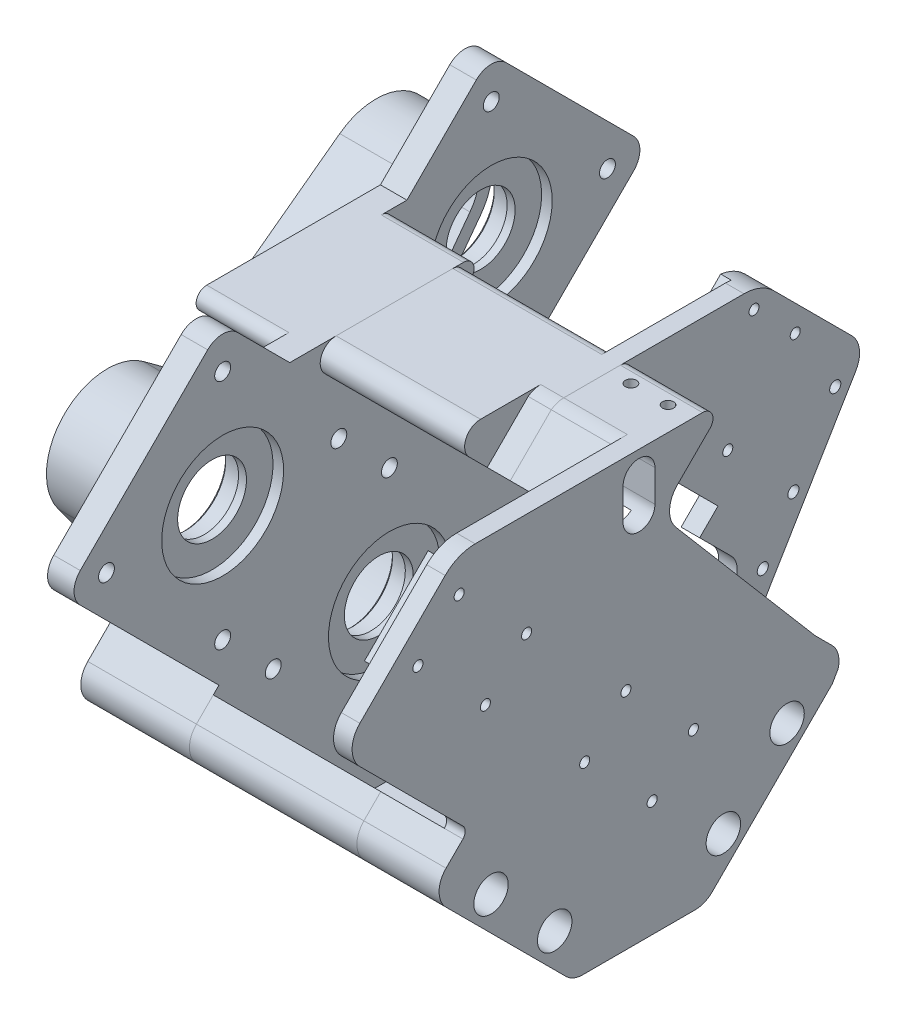
from build123d import *

# Parameters (mm, degrees)
SKETCH1_W                     = 42
SKETCH1_H                     = 42
BOSS_EXTRUDE1_DEPTH           = 5
SKETCH2_R                     = 1.5
CUT_EXTRUDE1_DEPTH            = 31.116440693
SKETCH3_R                     = 11.5
CUT_EXTRUDE2_DEPTH            = 31.116440693
SKETCH4_R                     = 3
CUT_EXTRUDE3_DEPTH            = 2
BOSS_EXTRUDE2_START           = -1.5
SKETCH5_R                     = 11.5
SKETCH5_R_2                   = 6.5
BOSS_EXTRUDE2_DEPTH           = 1.5
BOSS_EXTRUDE3_START           = 4
SKETCH6_R                     = 11.5
SKETCH6_R_2                   = 7.575
BOSS_EXTRUDE3_DEPTH           = 4
BODY_MOVE_COPY1_ANGLE         = 90
BODY_MOVE_COPY2_ANGLE         = 45
BODY_MOVE_COPY3_START         = -5
BODY_MOVE_COPY3_OUTLINE_R     = 3
BODY_MOVE_COPY3_OUTLINE_R_2   = 11.5
BODY_MOVE_COPY3_DEPTH         = 5
BODY_MOVE_COPY3_START_2       = -7.5
BODY_MOVE_COPY3_2_OUTLINE_R   = 11.5
BODY_MOVE_COPY3_2_OUTLINE_R_2 = 7.575
BODY_MOVE_COPY3_2_DEPTH       = 5.5
BODY_MOVE_COPY3_START_3       = -3
BODY_MOVE_COPY3_3_OUTLINE_R   = 3
BODY_MOVE_COPY3_3_OUTLINE_R_2 = 1.5
BODY_MOVE_COPY3_3_DEPTH       = 3
BODY_MOVE_COPY3_START_4       = -3.5
BODY_MOVE_COPY3_4_OUTLINE_R   = 7.575
BODY_MOVE_COPY3_4_OUTLINE_R_2 = 6.5
BODY_MOVE_COPY3_4_DEPTH       = 1.5
BODY_MOVE_COPY5_START         = -5
BODY_MOVE_COPY5_OUTLINE_R     = 3
BODY_MOVE_COPY5_OUTLINE_R_2   = 11.5
BODY_MOVE_COPY5_DEPTH         = 5
BODY_MOVE_COPY5_START_2       = -7.5
BODY_MOVE_COPY5_2_OUTLINE_R   = 11.5
BODY_MOVE_COPY5_2_OUTLINE_R_2 = 7.575
BODY_MOVE_COPY5_2_DEPTH       = 5.5
BODY_MOVE_COPY5_START_3       = -3
BODY_MOVE_COPY5_3_OUTLINE_R   = 3
BODY_MOVE_COPY5_3_OUTLINE_R_2 = 1.5
BODY_MOVE_COPY5_3_DEPTH       = 3
BODY_MOVE_COPY5_START_4       = -3.5
BODY_MOVE_COPY5_4_OUTLINE_R   = 7.575
BODY_MOVE_COPY5_4_OUTLINE_R_2 = 6.5
BODY_MOVE_COPY5_4_DEPTH       = 1.5
BOSS_EXTRUDE4_DEPTH           = 5
BOSS_EXTRUDE5_START           = -5
BOSS_EXTRUDE5_DEPTH           = 20.5
SKETCH12_R                    = 4.5
BOSS_EXTRUDE6_DEPTH           = 20.5
BOSS_EXTRUDE6_2_DEPTH         = 20.5
BOSS_EXTRUDE6_3_DEPTH         = 20.5
BOSS_EXTRUDE6_4_DEPTH         = 20.5
BOSS_EXTRUDE6_5_DEPTH         = 20.5
BOSS_EXTRUDE6_6_DEPTH         = 20.5
BOSS_EXTRUDE7_DEPTH           = 20.5
FILLET1_R                     = 2
FILLET3_R                     = 2
BOSS_EXTRUDE8_START           = -20.5
BOSS_EXTRUDE8_DEPTH           = 20.5
FILLET4_R                     = 4
CUT_EXTRUDE4_REACH            = 93.688
SKETCH15_R                    = 1.4
CUT_EXTRUDE5_REACH            = 93.688
SKETCH17_R                    = 1.4
CHAMFER1_SIZE                 = 0.5
BOSS_EXTRUDE9_DEPTH           = 2
SKETCH19_R                    = 0.95
CUT_EXTRUDE6_DEPTH            = 2
BOSS_EXTRUDE10_DEPTH          = 2
BOSS_EXTRUDE10_2_DEPTH        = 2
SKETCH22_R                    = 0.95
CUT_EXTRUDE7_DEPTH            = 2
BOSS_EXTRUDE11_DEPTH          = 28.1
FILLET5_R                     = 2
FILLET6_R                     = 3
BOSS_EXTRUDE12_DEPTH          = 28.1
BOSS_EXTRUDE13_DEPTH          = 3.5
BOSS_EXTRUDE14_DEPTH          = 12
BOSS_EXTRUDE14_2_DEPTH        = 12
BOSS_EXTRUDE15_DEPTH          = 3.5
SKETCH28_R                    = 3
CUT_EXTRUDE8_DEPTH            = 2
SKETCH29_R                    = 1.4
CUT_EXTRUDE9_DEPTH            = 67.6
SKETCH30_R                    = 3.25
CUT_EXTRUDE10_DEPTH           = 10
SKETCH31_R                    = 1.4
CUT_EXTRUDE11_DEPTH           = 67.6
CUT_EXTRUDE12_DEPTH           = 10
FILLET7_R                     = 5
CUT_EXTRUDE13_DEPTH           = 5.5
FILLET8_R                     = 8
FILLET9_R                     = 5
FILLET10_R                    = 8
FILLET11_R                    = 5
FILLET13_R                    = 1.5
CUT_EXTRUDE14_START           = -6.35
CUT_EXTRUDE14_DEPTH           = 16.35
FILLET14_R                    = 4
FILLET15_R                    = 4
CUT_EXTRUDE15_DEPTH           = 10
FILLET16_R                    = 3.9
CUT_EXTRUDE16_REACH           = 114.472
SKETCH37_R                    = 1.05
SKETCH38_R                    = 1.05
CUT_EXTRUDE17_DEPTH           = 3.5
SKETCH39_R                    = 1.05
CUT_EXTRUDE18_DEPTH           = 10
SKETCH40_R                    = 0.95
CUT_EXTRUDE19_DEPTH           = 5.5
SKETCH41_R                    = 0.95
CUT_EXTRUDE20_DEPTH           = 5.5
BOSS_EXTRUDE16_DEPTH          = 10.5
BOSS_EXTRUDE17_DEPTH          = 10.5


with BuildPart() as part:
    # Sketch1 → Boss-Extrude1 (new body)
    with BuildSketch(Plane(origin=(0, 0, 0), x_dir=(1, 0, 0), z_dir=(0, 1, 0))):
        Rectangle(SKETCH1_W, SKETCH1_H)
    extrude(amount=BOSS_EXTRUDE1_DEPTH)

    # Sketch2 → Cut-Extrude1 (cut, through all)
    with BuildSketch(Plane(origin=(0, 5, 0), x_dir=(1, 0, 0), z_dir=(0, 1, 0))):
        with Locations(Location((15.5, 15.5, 0), (0, 0, 270))):
            Circle(SKETCH2_R)
        with Locations(Location((15.5, -15.5, 0), (0, 0, 270))):
            Circle(SKETCH2_R)
        with Locations(Location((-15.5, -15.5, 0), (0, 0, 270))):
            Circle(SKETCH2_R)
        with Locations(Location((-15.5, 15.5, 0), (0, 0, 270))):
            Circle(SKETCH2_R)
    extrude(amount=-CUT_EXTRUDE1_DEPTH, mode=Mode.SUBTRACT)

    # Sketch3 → Cut-Extrude2 (cut, through all)
    with BuildSketch(Plane(origin=(0, 5, 0), x_dir=(1, 0, 0), z_dir=(0, 1, 0))):
        with Locations(Location((0, 0, 0), (0, 0, 270))):
            Circle(SKETCH3_R)
    extrude(amount=-CUT_EXTRUDE2_DEPTH, mode=Mode.SUBTRACT)

    # Sketch4 → Cut-Extrude3 (cut)
    with BuildSketch(Plane(origin=(0, 5, 0), x_dir=(1, 0, 0), z_dir=(0, 1, 0))):
        with Locations(Location((15.5, 15.5, 0), (0, 0, 270))):
            Circle(SKETCH4_R)
        with Locations(Location((15.5, -15.5, 0), (0, 0, 270))):
            Circle(SKETCH4_R)
        with Locations(Location((-15.5, -15.5, 0), (0, 0, 270))):
            Circle(SKETCH4_R)
        with Locations(Location((-15.5, 15.5, 0), (0, 0, 270))):
            Circle(SKETCH4_R)
    extrude(amount=-CUT_EXTRUDE3_DEPTH, mode=Mode.SUBTRACT)

    # Sketch5 → Boss-Extrude2 (add)
    with BuildSketch(Plane(origin=(0, 2, 0), x_dir=(-1, 0, 0), z_dir=(0, -1, 0)).offset(BOSS_EXTRUDE2_START)):
        with Locations(Location((0, 0, 0), (0, 0, 270))):
            Circle(SKETCH5_R)
        with Locations(Location((0, 0, 0), (0, 0, 90))):
            Circle(SKETCH5_R_2, mode=Mode.SUBTRACT)
    extrude(amount=BOSS_EXTRUDE2_DEPTH)

    # Sketch6 → Boss-Extrude3 (add)
    with BuildSketch(Plane(origin=(0, 3.5, 0), x_dir=(1, 0, 0), z_dir=(0, 1, 0)).offset(BOSS_EXTRUDE3_START)):
        with Locations(Location((0, 0, 0), (0, 0, 270))):
            Circle(SKETCH6_R)
        with Locations(Location((0, 0, 0), (0, 0, 270))):
            Circle(SKETCH6_R_2, mode=Mode.SUBTRACT)
    extrude(amount=-BOSS_EXTRUDE3_DEPTH)


with BuildPart() as part_1:
    # Body-Move/Copy1: moved
    add(part.part.rotate(Axis((0, 0, 0), (0, 0, 1)), BODY_MOVE_COPY1_ANGLE))


with BuildPart() as part_2:
    # Body-Move/Copy2: moved
    add(part_1.part.rotate(Axis((0, 0, 0), (1, 0, 0)), BODY_MOVE_COPY2_ANGLE))


with BuildPart() as body_2:
    # Body-Move/Copy3: read off the stored shape, not the designer's step
    # Body-Move/Copy3 outline → Body-Move/Copy3 (new body)
    with BuildSketch(Plane.YZ.offset(BODY_MOVE_COPY3_START)):
        Polygon((-29.69848481, 0), (0, -29.69848481), (29.69848481, 0), (0, 29.69848481), align=None)
        with Locations((0, -21.920310217)):
            Circle(BODY_MOVE_COPY3_OUTLINE_R, mode=Mode.SUBTRACT)
        with Locations((-21.920310217, 0)):
            Circle(BODY_MOVE_COPY3_OUTLINE_R, mode=Mode.SUBTRACT)
        Circle(BODY_MOVE_COPY3_OUTLINE_R_2, mode=Mode.SUBTRACT)
        with Locations((21.920310217, 0)):
            Circle(BODY_MOVE_COPY3_OUTLINE_R, mode=Mode.SUBTRACT)
        with Locations((0, 21.920310217)):
            Circle(BODY_MOVE_COPY3_OUTLINE_R, mode=Mode.SUBTRACT)
    extrude(amount=BODY_MOVE_COPY3_DEPTH)

    # Body-Move_Copy3 2 outline → Body-Move_Copy3 2 (add)
    with BuildSketch(Plane.YZ.offset(BODY_MOVE_COPY3_START_2)):
        Circle(BODY_MOVE_COPY3_2_OUTLINE_R)
        Circle(BODY_MOVE_COPY3_2_OUTLINE_R_2, mode=Mode.SUBTRACT)
    extrude(amount=BODY_MOVE_COPY3_2_DEPTH)

    # Body-Move_Copy3 3 outline → Body-Move_Copy3 3 (add)
    # profile 1 of 4: a face of its own
    with BuildSketch(Plane.YZ.offset(BODY_MOVE_COPY3_START_3)):
        with Locations((0, -21.920310217)):
            Circle(BODY_MOVE_COPY3_3_OUTLINE_R)
        with Locations((0, -21.920310217)):
            Circle(BODY_MOVE_COPY3_3_OUTLINE_R_2, mode=Mode.SUBTRACT)
    # profile 2 of 4: a face of its own
    with BuildSketch(Plane.YZ.offset(BODY_MOVE_COPY3_START_3)):
        with Locations((-21.920310217, 0)):
            Circle(BODY_MOVE_COPY3_3_OUTLINE_R)
        with Locations((-21.920310217, 0)):
            Circle(BODY_MOVE_COPY3_3_OUTLINE_R_2, mode=Mode.SUBTRACT)
    # profile 3 of 4: a face of its own
    with BuildSketch(Plane.YZ.offset(BODY_MOVE_COPY3_START_3)):
        with Locations((0, 21.920310217)):
            Circle(BODY_MOVE_COPY3_3_OUTLINE_R)
        with Locations((0, 21.920310217)):
            Circle(BODY_MOVE_COPY3_3_OUTLINE_R_2, mode=Mode.SUBTRACT)
    # profile 4 of 4: a face of its own
    with BuildSketch(Plane.YZ.offset(BODY_MOVE_COPY3_START_3)):
        with Locations((21.920310217, 0)):
            Circle(BODY_MOVE_COPY3_3_OUTLINE_R)
        with Locations((21.920310217, 0)):
            Circle(BODY_MOVE_COPY3_3_OUTLINE_R_2, mode=Mode.SUBTRACT)
    extrude(amount=BODY_MOVE_COPY3_3_DEPTH)

    # Body-Move_Copy3 4 outline → Body-Move_Copy3 4 (add)
    with BuildSketch(Plane.YZ.offset(BODY_MOVE_COPY3_START_4)):
        Circle(BODY_MOVE_COPY3_4_OUTLINE_R)
        Circle(BODY_MOVE_COPY3_4_OUTLINE_R_2, mode=Mode.SUBTRACT)
    extrude(amount=BODY_MOVE_COPY3_4_DEPTH)


with BuildPart() as part_3:
    # Body-Move/Copy4: read off the stored shape, not the designer's step
    # Body-Move/Copy4: moved
    add(part_2.part.moved(Location((0, 31.4662518, 31.4662518))))



with BuildPart() as body_3:
    # Body-Move/Copy5: read off the stored shape, not the designer's step
    # Body-Move/Copy5 outline → Body-Move/Copy5 (new body)
    with BuildSketch(Plane.YZ.offset(BODY_MOVE_COPY5_START)):
        Polygon((-29.69848481, 0), (0, -29.69848481), (29.69848481, 0), (0, 29.69848481), align=None)
        with Locations((0, -21.920310217)):
            Circle(BODY_MOVE_COPY5_OUTLINE_R, mode=Mode.SUBTRACT)
        with Locations((-21.920310217, 0)):
            Circle(BODY_MOVE_COPY5_OUTLINE_R, mode=Mode.SUBTRACT)
        Circle(BODY_MOVE_COPY5_OUTLINE_R_2, mode=Mode.SUBTRACT)
        with Locations((21.920310217, 0)):
            Circle(BODY_MOVE_COPY5_OUTLINE_R, mode=Mode.SUBTRACT)
        with Locations((0, 21.920310217)):
            Circle(BODY_MOVE_COPY5_OUTLINE_R, mode=Mode.SUBTRACT)
    extrude(amount=BODY_MOVE_COPY5_DEPTH)

    # Body-Move_Copy5 2 outline → Body-Move_Copy5 2 (add)
    with BuildSketch(Plane.YZ.offset(BODY_MOVE_COPY5_START_2)):
        Circle(BODY_MOVE_COPY5_2_OUTLINE_R)
        Circle(BODY_MOVE_COPY5_2_OUTLINE_R_2, mode=Mode.SUBTRACT)
    extrude(amount=BODY_MOVE_COPY5_2_DEPTH)

    # Body-Move_Copy5 3 outline → Body-Move_Copy5 3 (add)
    # profile 1 of 4: a face of its own
    with BuildSketch(Plane.YZ.offset(BODY_MOVE_COPY5_START_3)):
        with Locations((0, -21.920310217)):
            Circle(BODY_MOVE_COPY5_3_OUTLINE_R)
        with Locations((0, -21.920310217)):
            Circle(BODY_MOVE_COPY5_3_OUTLINE_R_2, mode=Mode.SUBTRACT)
    # profile 2 of 4: a face of its own
    with BuildSketch(Plane.YZ.offset(BODY_MOVE_COPY5_START_3)):
        with Locations((-21.920310217, 0)):
            Circle(BODY_MOVE_COPY5_3_OUTLINE_R)
        with Locations((-21.920310217, 0)):
            Circle(BODY_MOVE_COPY5_3_OUTLINE_R_2, mode=Mode.SUBTRACT)
    # profile 3 of 4: a face of its own
    with BuildSketch(Plane.YZ.offset(BODY_MOVE_COPY5_START_3)):
        with Locations((0, 21.920310217)):
            Circle(BODY_MOVE_COPY5_3_OUTLINE_R)
        with Locations((0, 21.920310217)):
            Circle(BODY_MOVE_COPY5_3_OUTLINE_R_2, mode=Mode.SUBTRACT)
    # profile 4 of 4: a face of its own
    with BuildSketch(Plane.YZ.offset(BODY_MOVE_COPY5_START_3)):
        with Locations((21.920310217, 0)):
            Circle(BODY_MOVE_COPY5_3_OUTLINE_R)
        with Locations((21.920310217, 0)):
            Circle(BODY_MOVE_COPY5_3_OUTLINE_R_2, mode=Mode.SUBTRACT)
    extrude(amount=BODY_MOVE_COPY5_3_DEPTH)

    # Body-Move_Copy5 4 outline → Body-Move_Copy5 4 (add)
    with BuildSketch(Plane.YZ.offset(BODY_MOVE_COPY5_START_4)):
        Circle(BODY_MOVE_COPY5_4_OUTLINE_R)
        Circle(BODY_MOVE_COPY5_4_OUTLINE_R_2, mode=Mode.SUBTRACT)
    extrude(amount=BODY_MOVE_COPY5_4_DEPTH)


with BuildPart() as body_2_1:
    # Body-Move/Copy6: read off the stored shape, not the designer's step
    # Body-Move/Copy6: moved
    add(body_2.part.moved(Location((-15.5, 34.718943, -34.718943))))


with BuildPart() as part_4:
    add(part_3.part)

    add(body_3.part)  # Boss-Extrude4 merges body 3
    # Sketch10 → Boss-Extrude4 (add)
    with BuildSketch(Plane.ZY.offset(5)):
        Polygon((29.69848481, 0), (31.466251763, 1.767766953), (1.767766953, 31.466251763), (0, 29.69848481), align=None)
    extrude(amount=-BOSS_EXTRUDE4_DEPTH)


    add(body_2_1.part)  # Boss-Extrude5 merges body 2
    # Sketch11 → Boss-Extrude5 (add)
    with BuildSketch(Plane.ZY.offset(5).offset(BOSS_EXTRUDE5_START)):
        Polygon((-29.69848481, 0), (-34.718942956, 5.020458146), (-5.020458146, 34.718942956), (0, 29.69848481), align=None)
    extrude(amount=BOSS_EXTRUDE5_DEPTH)



with BuildPart() as body_2_2:
    # Sketch12 → Boss-Extrude6 (new body)
    with BuildSketch(Plane(origin=(0, 0, 0), x_dir=(0, 0, -1), z_dir=(1, 0, 0))):
        with Locations((6, 44)):
            Circle(SKETCH12_R)
    extrude(amount=-BOSS_EXTRUDE6_DEPTH)


with BuildPart() as body_3_2:
    # Sketch12 → Boss-Extrude6 2 (new body)
    with BuildSketch(Plane(origin=(0, 0, 0), x_dir=(0, 0, -1), z_dir=(1, 0, 0))):
        with Locations(Location((-6, 44, 0), (0, 0, 180))):
            Circle(SKETCH12_R)
    extrude(amount=-BOSS_EXTRUDE6_2_DEPTH)


with BuildPart() as body_4:
    # Sketch12 → Boss-Extrude6 3 (new body)
    with BuildSketch(Plane(origin=(0, 0, 0), x_dir=(0, 0, -1), z_dir=(1, 0, 0))):
        with Locations((33.234018716, -4.949747468)):
            Circle(SKETCH12_R)
    extrude(amount=-BOSS_EXTRUDE6_3_DEPTH)


with BuildPart() as body_5:
    # Sketch12 → Boss-Extrude6 4 (new body)
    with BuildSketch(Plane(origin=(0, 0, 0), x_dir=(0, 0, -1), z_dir=(1, 0, 0))):
        with Locations(Location((-33.234018716, -4.949747468, 0), (0, 0, 180))):
            Circle(SKETCH12_R)
    extrude(amount=-BOSS_EXTRUDE6_4_DEPTH)


with BuildPart() as body_6:
    # Sketch12 → Boss-Extrude6 5 (new body)
    with BuildSketch(Plane(origin=(0, 0, 0), x_dir=(0, 0, -1), z_dir=(1, 0, 0))):
        with Locations((10.606601718, -27.577164466)):
            Circle(SKETCH12_R)
    extrude(amount=-BOSS_EXTRUDE6_5_DEPTH)


with BuildPart() as body_7:
    # Sketch12 → Boss-Extrude6 6 (new body)
    with BuildSketch(Plane(origin=(0, 0, 0), x_dir=(0, 0, -1), z_dir=(1, 0, 0))):
        with Locations(Location((-10.606601718, -27.577164466, 0), (0, 0, 180))):
            Circle(SKETCH12_R)
    extrude(amount=-BOSS_EXTRUDE6_6_DEPTH)


with BuildPart() as part_5:
    add(part_4.part)

    add(body_2_2.part)  # Boss-Extrude7 merges body 2 2

    add(body_3_2.part)  # Boss-Extrude7 merges body 3 2
    # Sketch13 → Boss-Extrude7 (add)
    with BuildSketch(Plane(origin=(0, 0, 0), x_dir=(0, 0, -1), z_dir=(1, 0, 0))):
        Polygon((18.80151519, 48.5), (-18.80151519, 48.5), (0, 29.69848481), align=None)
    extrude(amount=-BOSS_EXTRUDE7_DEPTH)

    # Fillet1
    fillet1_edges = [part_5.edges().sort_by_distance(p)[0] for p in [
        (-7.75, 48.5, -18.80151519),
    ]]
    fillet(fillet1_edges, radius=FILLET1_R)

    # Fillet3
    fillet3_edges = [part_5.edges().sort_by_distance(p)[0] for p in [
        (-12.75, 48.5, 18.80151519),
    ]]
    fillet(fillet3_edges, radius=FILLET3_R)


    add(body_4.part)  # Boss-Extrude8 merges body 4

    add(body_5.part)  # Boss-Extrude8 merges body 5

    add(body_6.part)  # Boss-Extrude8 merges body 6

    add(body_7.part)  # Boss-Extrude8 merges body 7
    # Sketch14 → Boss-Extrude8 (add)
    with BuildSketch(Plane(origin=(0, 0, 0), x_dir=(0, 0, -1), z_dir=(1, 0, 0)).offset(BOSS_EXTRUDE8_START)):
        with BuildLine():
            Line((10.606601718, -32.077164466), (-10.606601718, -32.077164466))
            ThreePointArc((-10.606601718, -32.077164466), (-12.328677163, -31.734622363), (-13.788582233, -30.759144982))
            Line((-13.788582233, -30.759144982), (-36.415999231, -8.131727984))
            ThreePointArc((-36.415999231, -8.131727984), (-37.734018716, -4.949747468), (-36.415999231, -1.767766953))
            Line((-36.415999231, -1.767766953), (-32.173358544, 2.474873734))
            Line((-32.173358544, 2.474873734), (0, -29.69848481))
            Line((0, -29.69848481), (32.173358544, 2.474873734))
            Line((32.173358544, 2.474873734), (36.415999231, -1.767766953))
            ThreePointArc((36.415999231, -1.767766953), (37.734018716, -4.949747468), (36.415999231, -8.131727984))
            Line((36.415999231, -8.131727984), (13.788582233, -30.759144982))
            ThreePointArc((13.788582233, -30.759144982), (12.328677163, -31.734622363), (10.606601718, -32.077164466))
        make_face()
    extrude(amount=BOSS_EXTRUDE8_DEPTH)

    # Fillet4
    fillet4_edges = [part_5.edges().sort_by_distance(p)[0] for p in [
        (-18, 34.718943, -64.41742781),
        (-18, 64.41742781, -34.718943),
        (-2.5, 61.16473661, 31.4662518),
        (-2.5, 31.4662518, 61.16473661),
    ]]
    fillet(fillet4_edges, radius=FILLET4_R)

    # Sketch15 → Cut-Extrude4 (cut, up to next)
    with BuildSketch(Plane(origin=(0, 0, 0), x_dir=(0, 0, -1), z_dir=(1, 0, 0)), mode=Mode.PRIVATE) as cut_extrude4_sk1:
        with Locations((-33.234018716, -4.949747468)):
            Circle(SKETCH15_R)
    cut_extrude4_tool1 = extrude(cut_extrude4_sk1.sketch, amount=-CUT_EXTRUDE4_REACH, mode=Mode.PRIVATE) & part_5.part
    # Sketch15 → Cut-Extrude4 (cut, up to next)
    with BuildSketch(Plane(origin=(0, 0, 0), x_dir=(0, 0, -1), z_dir=(1, 0, 0)), mode=Mode.PRIVATE) as cut_extrude4_sk2:
        with Locations((-10.606601718, -27.577164466)):
            Circle(SKETCH15_R)
    cut_extrude4_tool2 = extrude(cut_extrude4_sk2.sketch, amount=-CUT_EXTRUDE4_REACH, mode=Mode.PRIVATE) & part_5.part
    # Sketch15 → Cut-Extrude4 (cut, up to next)
    with BuildSketch(Plane(origin=(0, 0, 0), x_dir=(0, 0, -1), z_dir=(1, 0, 0)), mode=Mode.PRIVATE) as cut_extrude4_sk3:
        with Locations((10.606601718, -27.577164466)):
            Circle(SKETCH15_R)
    cut_extrude4_tool3 = extrude(cut_extrude4_sk3.sketch, amount=-CUT_EXTRUDE4_REACH, mode=Mode.PRIVATE) & part_5.part
    # Sketch15 → Cut-Extrude4 (cut, up to next)
    with BuildSketch(Plane(origin=(0, 0, 0), x_dir=(0, 0, -1), z_dir=(1, 0, 0)), mode=Mode.PRIVATE) as cut_extrude4_sk4:
        with Locations((33.234018716, -4.949747468)):
            Circle(SKETCH15_R)
    cut_extrude4_tool4 = extrude(cut_extrude4_sk4.sketch, amount=-CUT_EXTRUDE4_REACH, mode=Mode.PRIVATE) & part_5.part
    add(cut_extrude4_tool1.solids().sort_by_distance((0, -4.949747, 33.234019))[0], mode=Mode.SUBTRACT)
    add(cut_extrude4_tool2.solids().sort_by_distance((0, -27.577164, 10.606602))[0], mode=Mode.SUBTRACT)
    add(cut_extrude4_tool3.solids().sort_by_distance((0, -27.577164, -10.606602))[0], mode=Mode.SUBTRACT)
    add(cut_extrude4_tool4.solids().sort_by_distance((0, -4.949747, -33.234019))[0], mode=Mode.SUBTRACT)

    # Sketch17 → Cut-Extrude5 (cut, up to next)
    with BuildSketch(Plane(origin=(0, 0, 0), x_dir=(0, 0, -1), z_dir=(1, 0, 0)), mode=Mode.PRIVATE) as cut_extrude5_sk1:
        with Locations((-6, 44)):
            Circle(SKETCH17_R)
    cut_extrude5_tool1 = extrude(cut_extrude5_sk1.sketch, amount=-CUT_EXTRUDE5_REACH, mode=Mode.PRIVATE) & part_5.part
    # Sketch17 → Cut-Extrude5 (cut, up to next)
    with BuildSketch(Plane(origin=(0, 0, 0), x_dir=(0, 0, -1), z_dir=(1, 0, 0)), mode=Mode.PRIVATE) as cut_extrude5_sk2:
        with Locations((6, 44)):
            Circle(SKETCH17_R)
    cut_extrude5_tool2 = extrude(cut_extrude5_sk2.sketch, amount=-CUT_EXTRUDE5_REACH, mode=Mode.PRIVATE) & part_5.part
    add(cut_extrude5_tool1.solids().sort_by_distance((0, 44, 6))[0], mode=Mode.SUBTRACT)
    add(cut_extrude5_tool2.solids().sort_by_distance((0, 44, -6))[0], mode=Mode.SUBTRACT)

    # Chamfer1
    chamfer1_edges = [part_5.edges().sort_by_distance(p)[0] for p in [
        (-23, 27.143943, -34.718943),
        (-7.5, -7.575, 0),
        (-7.5, 36.822585667, 26.109917933),
    ]]
    chamfer(chamfer1_edges, length=CHAMFER1_SIZE)

    # Sketch28 → Cut-Extrude8 (cut)
    with BuildSketch(Plane(origin=(0, 0, 0), x_dir=(0, 0, -1), z_dir=(1, 0, 0))):
        with Locations((-6, 44)):
            Circle(SKETCH28_R)
        with Locations((6, 44)):
            Circle(SKETCH28_R)
        with Locations((33.234018716, -4.949747468)):
            Circle(SKETCH28_R)
        with Locations((10.606601718, -27.577164466)):
            Circle(SKETCH28_R)
        with Locations((-10.606601718, -27.577164466)):
            Circle(SKETCH28_R)
        with Locations((-33.234018716, -4.949747468)):
            Circle(SKETCH28_R)
    extrude(amount=-CUT_EXTRUDE8_DEPTH, mode=Mode.SUBTRACT)


with BuildPart() as body_2_3:
    # Sketch18 → Boss-Extrude9 (new body)
    with BuildSketch(Plane(origin=(26.1, 0, 0), x_dir=(0, 0, -1), z_dir=(1, 0, 0))):
        Polygon((49.568185361, 37.547370081), (37.547370081, 49.568185361), (19.869700551, 31.890515832), (31.890515832, 19.869700551), align=None)
    extrude(amount=BOSS_EXTRUDE9_DEPTH)

    # Sketch19 → Cut-Extrude6 (cut)
    with BuildSketch(Plane(origin=(28.1, 0, 0), x_dir=(0, 0, -1), z_dir=(1, 0, 0))):
        with Locations((44.971991283, 37.19381669)):
            Circle(SKETCH19_R)
        with Locations((37.19381669, 44.971991283)):
            Circle(SKETCH19_R)
        with Locations((24.465894629, 32.244069222)):
            Circle(SKETCH19_R)
        with Locations((32.244069222, 24.465894629)):
            Circle(SKETCH19_R)
    extrude(amount=-CUT_EXTRUDE6_DEPTH, mode=Mode.SUBTRACT)



with BuildPart() as body_3_3:
    # Sketch21 → Boss-Extrude10 (new body)
    with BuildSketch(Plane(origin=(41.6, 0, 0), x_dir=(0, 0, -1), z_dir=(1, 0, 0))):
        Polygon((-2.828427125, 14.849242405), (14.849242405, -2.828427125), (2.828427125, -14.849242405), (-14.849242405, 2.828427125), align=None)
    extrude(amount=BOSS_EXTRUDE10_DEPTH)


with BuildPart() as body_4_2:
    # Sketch21 → Boss-Extrude10 2 (new body)
    with BuildSketch(Plane(origin=(41.6, 0, 0), x_dir=(0, 0, -1), z_dir=(1, 0, 0))):
        Polygon((-16.617009358, 28.637824638), (-34.294678888, 46.315494168), (-46.315494168, 34.294678888), (-28.637824638, 16.617009358), align=None)
    extrude(amount=BOSS_EXTRUDE10_2_DEPTH)


with BuildPart() as cut_extrude7_tool:
    # Sketch22 → Cut-Extrude7 (new body)
    with BuildSketch(Plane(origin=(43.6, 0, 0), x_dir=(0, 0, -1), z_dir=(1, 0, 0))):
        with Locations((-33.941125497, 41.71930009)):
            Circle(SKETCH22_R)
        with Locations((-21.213203436, 28.991378029)):
            Circle(SKETCH22_R)
        with Locations((-28.991378029, 21.213203436)):
            Circle(SKETCH22_R)
        with Locations((-41.71930009, 33.941125497)):
            Circle(SKETCH22_R)
        with Locations((-2.474873734, 10.253048327)):
            Circle(SKETCH22_R)
        with Locations((10.253048327, -2.474873734)):
            Circle(SKETCH22_R)
        with Locations((2.474873734, -10.253048327)):
            Circle(SKETCH22_R)
        with Locations((-10.253048327, 2.474873734)):
            Circle(SKETCH22_R)
    extrude(amount=-CUT_EXTRUDE7_DEPTH)


with BuildPart() as body_3_3_1:
    add(body_3_3.part)

    # Cut-Extrude7: cut by cut_extrude7_tool
    add(cut_extrude7_tool.part, mode=Mode.SUBTRACT)



with BuildPart() as body_4_2_1:
    add(body_4_2.part)

    # Cut-Extrude7: cut by cut_extrude7_tool
    add(cut_extrude7_tool.part, mode=Mode.SUBTRACT)


with BuildPart() as body_5_2:
    # Sketch23 → Boss-Extrude11 (new body)
    with BuildSketch(Plane(origin=(0, 0, 0), x_dir=(0, 0, -1), z_dir=(1, 0, 0))):
        Polygon((13.973088065, 48.5), (-17.30151519, 48.5), (-4.581118318, 35.779603128), (3.959797975, 35.779603128), (13.973088065, 45.792893219), align=None)
    extrude(amount=BOSS_EXTRUDE11_DEPTH)

    # Fillet5
    # the kernel refuses this fillet: 2 mm, written as the material it takes off along each edge
    with BuildSketch(Plane(origin=(-2.071067812, 45.792893219, -13.973088065), x_dir=(0, -0.7071067811865218, 0.7071067811865732), z_dir=(1, 0, 0))) as fillet5_piece_1:
        with BuildLine():
            CenterArc((FILLET5_R * 0.414213562373, -FILLET5_R), FILLET5_R, 90, 45)
            Line((-FILLET5_R * 0.292893218813, -FILLET5_R * 0.292893218813), (0, 0))
            Line((0, 0), (FILLET5_R * 0.414213562373, 0))
        make_face()
    extrude(amount=32.242135624, mode=Mode.SUBTRACT)
    with BuildSketch(Plane(origin=(-5, 48.5, -13.973088065), x_dir=(0, 0, 1), z_dir=(1, 0, 0))) as fillet5_piece_2:
        with BuildLine():
            CenterArc((FILLET5_R, FILLET5_R), FILLET5_R, 180, 90)
            Line((0, FILLET5_R), (0, 0))
            Line((0, 0), (FILLET5_R, 0))
        make_face()
    extrude(amount=38.1, mode=Mode.SUBTRACT)

    # Fillet6
    fillet6_edges = [body_5_2.edges().sort_by_distance(p)[0] for p in [
        (14.05, 48.5, 17.30151519),
    ]]
    fillet(fillet6_edges, radius=FILLET6_R)


with BuildPart() as body_6_2:
    # Sketch24 → Boss-Extrude12 (new body)
    with BuildSketch(Plane(origin=(0, 0, 0), x_dir=(0, 0, -1), z_dir=(1, 0, 0))):
        with BuildLine():
            Line((-33.234018716, 1.414213562), (-2.742640687, -29.077164466))
            Line((-2.742640687, -29.077164466), (0, -29.077164466))
            Line((0, -29.077164466), (2.742640687, -29.077164466))
            Line((2.742640687, -29.077164466), (33.234018716, 1.414213562))
            Line((33.234018716, 1.414213562), (36.415999231, -1.767766953))
            ThreePointArc((36.415999231, -1.767766953), (37.734018716, -4.949747468), (36.415999231, -8.131727984))
            Line((36.415999231, -8.131727984), (13.788582233, -30.759144982))
            ThreePointArc((13.788582233, -30.759144982), (12.328677163, -31.734622363), (10.606601718, -32.077164466))
            Line((10.606601718, -32.077164466), (0, -32.077164466))
            Line((0, -32.077164466), (-10.606601718, -32.077164466))
            ThreePointArc((-10.606601718, -32.077164466), (-12.328677163, -31.734622363), (-13.788582233, -30.759144982))
            Line((-13.788582233, -30.759144982), (-36.415999231, -8.131727984))
            ThreePointArc((-36.415999231, -8.131727984), (-37.734018716, -4.949747468), (-36.415999231, -1.767766953))
            Line((-36.415999231, -1.767766953), (-33.234018716, 1.414213562))
        make_face()
    extrude(amount=BOSS_EXTRUDE12_DEPTH)


with BuildPart() as body_2_3_1:
    add(body_2_3.part)

    add(body_5_2.part)  # Boss-Extrude13 merges body 5 2

    add(body_6_2.part)  # Boss-Extrude13 merges body 6 2
    # Sketch25 → Boss-Extrude13 (add)
    with BuildSketch(Plane(origin=(28.1, 0, 0), x_dir=(0, 0, -1), z_dir=(1, 0, 0))):
        with BuildLine():
            Line((11.973088065, 48.5), (38.615555442, 48.5))
            Line((38.615555442, 48.5), (58.407020126, 28.708535316))
            Line((58.407020126, 28.708535316), (36.415999231, -8.131727984))
            Line((36.415999231, -8.131727984), (13.788582233, -30.759144982))
            ThreePointArc((13.788582233, -30.759144982), (12.328677163, -31.734622363), (10.606601718, -32.077164466))
            Line((10.606601718, -32.077164466), (-10.606601718, -32.077164466))
            ThreePointArc((-10.606601718, -32.077164466), (-12.328677163, -31.734622363), (-13.788582233, -30.759144982))
            Line((-13.788582233, -30.759144982), (-36.415999231, -8.131727984))
            ThreePointArc((-36.415999231, -8.131727984), (-37.734018716, -4.949747468), (-36.415999231, -1.767766953))
            Line((-36.415999231, -1.767766953), (-33.234018716, 1.414213562))
            Line((-33.234018716, 1.414213562), (-2.742640687, -29.077164466))
            Line((-2.742640687, -29.077164466), (2.742640687, -29.077164466))
            Line((2.742640687, -29.077164466), (33.234018716, 1.414213562))
            Line((33.234018716, 1.414213562), (34.718942956, 5.020458146))
            Line((34.718942956, 5.020458146), (3.959797975, 35.779603128))
            Line((3.959797975, 35.779603128), (-4.581118318, 35.779603128))
            Line((-4.581118318, 35.779603128), (-12.180194847, 43.378679656))
            ThreePointArc((-12.180194847, 43.378679656), (-12.830513101, 46.648050297), (-10.058874503, 48.5))
            Line((-10.058874503, 48.5), (11.973088065, 48.5))
        make_face()
    extrude(amount=BOSS_EXTRUDE13_DEPTH)


with BuildPart() as body_5_3:
    # Sketch26 → Boss-Extrude14 (new body)
    with BuildSketch(Plane(origin=(31.6, 0, 0), x_dir=(0, 0, -1), z_dir=(1, 0, 0))):
        with BuildLine():
            Line((3.959797975, 35.779603128), (13.387301628, 45.207106781))
            ThreePointArc((13.387301628, 45.207106781), (13.80902644, 45.828016944), (13.97216794, 46.560660172))
            ThreePointArc((13.97216794, 46.560660172), (13.365689885, 47.935499973), (11.973088065, 48.5))
            Line((11.973088065, 48.5), (-10.058874503, 48.5))
            ThreePointArc((-10.058874503, 48.5), (-12.830513101, 46.648050297), (-12.180194847, 43.378679656))
            Line((-12.180194847, 43.378679656), (-4.581118318, 35.779603128))
            Line((-4.581118318, 35.779603128), (3.959797975, 35.779603128))
        make_face()
    extrude(amount=BOSS_EXTRUDE14_DEPTH)


with BuildPart() as body_6_3:
    # Sketch26 → Boss-Extrude14 2 (new body)
    with BuildSketch(Plane(origin=(31.6, 0, 0), x_dir=(0, 0, -1), z_dir=(1, 0, 0))):
        with BuildLine():
            Line((36.415999231, -1.767766953), (33.234018716, 1.414213562))
            Line((33.234018716, 1.414213562), (2.742640687, -29.077164466))
            Line((2.742640687, -29.077164466), (-2.742640687, -29.077164466))
            Line((-2.742640687, -29.077164466), (-33.234018716, 1.414213562))
            Line((-33.234018716, 1.414213562), (-36.415999231, -1.767766953))
            ThreePointArc((-36.415999231, -1.767766953), (-37.734018716, -4.949747468), (-36.415999231, -8.131727984))
            Line((-36.415999231, -8.131727984), (-13.788582233, -30.759144982))
            ThreePointArc((-13.788582233, -30.759144982), (-12.328677163, -31.734622363), (-10.606601718, -32.077164466))
            Line((-10.606601718, -32.077164466), (10.606601718, -32.077164466))
            ThreePointArc((10.606601718, -32.077164466), (12.328677163, -31.734622363), (13.788582233, -30.759144982))
            Line((13.788582233, -30.759144982), (36.415999231, -8.131727984))
            Line((36.415999231, -8.131727984), (37.544932404, -6.240492668))
            ThreePointArc((37.544932404, -6.240492668), (37.597180954, -3.848468538), (36.415999231, -1.767766953))
        make_face()
    extrude(amount=BOSS_EXTRUDE14_2_DEPTH)


with BuildPart() as body_3_3_2:
    add(body_3_3_1.part)

    add(body_4_2_1.part)  # Boss-Extrude15 merges body 4 2

    add(body_5_3.part)  # Boss-Extrude15 merges body 5 3

    add(body_6_3.part)  # Boss-Extrude15 merges body 6 3
    # Sketch27 → Boss-Extrude15 (add)
    with BuildSketch(Plane(origin=(43.6, 0, 0), x_dir=(0, 0, -1), z_dir=(1, 0, 0))):
        with BuildLine():
            Line((3.959797975, 35.779603128), (33.234018716, 1.414213562))
            Line((33.234018716, 1.414213562), (36.415999231, -1.767766953))
            ThreePointArc((36.415999231, -1.767766953), (37.597180954, -3.848468538), (37.544932404, -6.240492668))
            Line((37.544932404, -6.240492668), (36.415999231, -8.131727984))
            Line((36.415999231, -8.131727984), (13.788582233, -30.759144982))
            ThreePointArc((13.788582233, -30.759144982), (12.328677163, -31.734622363), (10.606601718, -32.077164466))
            Line((10.606601718, -32.077164466), (-10.606601718, -32.077164466))
            ThreePointArc((-10.606601718, -32.077164466), (-12.328677163, -31.734622363), (-13.788582233, -30.759144982))
            Line((-13.788582233, -30.759144982), (-36.415999231, -8.131727984))
            ThreePointArc((-36.415999231, -8.131727984), (-37.734018716, -4.949747468), (-36.415999231, -1.767766953))
            Line((-36.415999231, -1.767766953), (-33.234018716, 1.414213562))
            Line((-33.234018716, 1.414213562), (-32.173358544, 2.474873734))
            Line((-32.173358544, 2.474873734), (-56.214989104, 26.516504294))
            Line((-56.214989104, 26.516504294), (-34.231493399, 48.5))
            Line((-34.231493399, 48.5), (-10.058874503, 48.5))
            Line((-10.058874503, 48.5), (11.973088065, 48.5))
            ThreePointArc((11.973088065, 48.5), (13.365689885, 47.935499973), (13.97216794, 46.560660172))
            ThreePointArc((13.97216794, 46.560660172), (13.80902644, 45.828016944), (13.387301628, 45.207106781))
            Line((13.387301628, 45.207106781), (3.959797975, 35.779603128))
        make_face()
    extrude(amount=BOSS_EXTRUDE15_DEPTH)


with BuildPart() as cut_extrude9_tool:
    # Sketch29 → Cut-Extrude9 (new body)
    with BuildSketch(Plane(origin=(47.1, 0, 0), x_dir=(0, 0, -1), z_dir=(1, 0, 0))):
        with Locations((27.930717857, -10.253048327)):
            Circle(SKETCH29_R)
        with Locations((-27.930717857, -10.253048327)):
            Circle(SKETCH29_R)
        with Locations((-15.909902577, -22.273863607)):
            Circle(SKETCH29_R)
        with Locations((15.909902577, -22.273863607)):
            Circle(SKETCH29_R)
    extrude(amount=-CUT_EXTRUDE9_DEPTH)


with BuildPart() as part_6:
    add(part_5.part)

    # Cut-Extrude9: cut by cut_extrude9_tool
    add(cut_extrude9_tool.part, mode=Mode.SUBTRACT)


with BuildPart() as body_2_3_2:
    add(body_2_3_1.part)

    # Cut-Extrude9: cut by cut_extrude9_tool
    add(cut_extrude9_tool.part, mode=Mode.SUBTRACT)


with BuildPart() as body_3_3_3:
    add(body_3_3_2.part)

    # Cut-Extrude9: cut by cut_extrude9_tool
    add(cut_extrude9_tool.part, mode=Mode.SUBTRACT)

    # Sketch30 → Cut-Extrude10 (cut)
    with BuildSketch(Plane(origin=(47.1, 0, 0), x_dir=(0, 0, -1), z_dir=(1, 0, 0))):
        with Locations((-15.909902577, -22.273863607)):
            Circle(SKETCH30_R)
        with Locations((-27.930717857, -10.253048327)):
            Circle(SKETCH30_R)
        with Locations((15.909902577, -22.273863607)):
            Circle(SKETCH30_R)
        with Locations((27.930717857, -10.253048327)):
            Circle(SKETCH30_R)
    extrude(amount=-CUT_EXTRUDE10_DEPTH, mode=Mode.SUBTRACT)


with BuildPart() as cut_extrude11_tool:
    # Sketch31 → Cut-Extrude11 (new body)
    with BuildSketch(Plane(origin=(47.1, 0, 0), x_dir=(0, 0, -1), z_dir=(1, 0, 0))):
        with Locations((0, 44)):
            Circle(SKETCH31_R)
        with Locations((0, 38)):
            Circle(SKETCH31_R)
    extrude(amount=-CUT_EXTRUDE11_DEPTH)


with BuildPart() as part_7:
    add(part_6.part)

    # Cut-Extrude11: cut by cut_extrude11_tool
    add(cut_extrude11_tool.part, mode=Mode.SUBTRACT)


with BuildPart() as body_2_3_3:
    add(body_2_3_2.part)

    # Cut-Extrude11: cut by cut_extrude11_tool
    add(cut_extrude11_tool.part, mode=Mode.SUBTRACT)

    # Sketch33 → Cut-Extrude13 (cut)
    with BuildSketch(Plane(origin=(31.6, 0, 0), x_dir=(0, 0, -1), z_dir=(1, 0, 0))):
        Polygon((37.547370081, 49.568185361), (36.47918472, 48.5), (38.615555442, 48.5), align=None)
    extrude(amount=-CUT_EXTRUDE13_DEPTH, mode=Mode.SUBTRACT)

    # Fillet8
    fillet8_edges = [body_2_3_3.edges().sort_by_distance(p)[0] for p in [
        (28.85, 48.5, -38.615555442),
    ]]
    fillet(fillet8_edges, radius=FILLET8_R)

    # Fillet9
    fillet9_edges = [body_2_3_3.edges().sort_by_distance(p)[0] for p in [
        (29.85, 28.708535316, -58.407020126),
    ]]
    fillet(fillet9_edges, radius=FILLET9_R)


with BuildPart() as body_3_3_4:
    add(body_3_3_3.part)

    # Cut-Extrude11: cut by cut_extrude11_tool
    add(cut_extrude11_tool.part, mode=Mode.SUBTRACT)

    # Sketch32 → Cut-Extrude12 (cut)
    with BuildSketch(Plane(origin=(47.1, 0, 0), x_dir=(0, 0, -1), z_dir=(1, 0, 0))):
        with BuildLine():
            Line((3, 44), (3, 38))
            ThreePointArc((3, 38), (0, 35), (-3, 38))
            Line((-3, 38), (-3, 44))
            ThreePointArc((-3, 44), (0, 47), (3, 44))
        make_face()
    extrude(amount=-CUT_EXTRUDE12_DEPTH, mode=Mode.SUBTRACT)

    # Fillet7
    fillet7_edges = [body_3_3_4.edges().sort_by_distance(p)[0] for p in [
        (45.35, 35.779603128, -3.959797975),
    ]]
    fillet(fillet7_edges, radius=FILLET7_R)

    # Fillet10
    fillet10_edges = [body_3_3_4.edges().sort_by_distance(p)[0] for p in [
        (45.35, 48.5, 34.231493399),
    ]]
    fillet(fillet10_edges, radius=FILLET10_R)

    # Fillet11
    fillet11_edges = [body_3_3_4.edges().sort_by_distance(p)[0] for p in [
        (45.35, 26.516504295, 56.214989104),
    ]]
    fillet(fillet11_edges, radius=FILLET11_R)

    # Fillet13
    fillet13_edges = [body_3_3_4.edges().sort_by_distance(p)[0] for p in [
        (45.35, 2.474873734, 32.173358544),
    ]]
    fillet(fillet13_edges, radius=FILLET13_R - 0.0001)  # a hair under: the kernel refuses the full size


with BuildPart() as cut_extrude14_tool:
    # Sketch34 → Cut-Extrude14 (new body)
    with BuildSketch(Plane.ZY.offset(-37.25).offset(CUT_EXTRUDE14_START)):
        Polygon((15.202795796, 61.871843354), (1.060660172, 47.72970773), (18.03122292, 30.759144982), (32.173358544, 44.901280605), align=None)
    extrude(amount=CUT_EXTRUDE14_DEPTH)


with BuildPart() as body_2_3_4:
    add(body_2_3_3.part)

    # Cut-Extrude14: cut by cut_extrude14_tool
    add(cut_extrude14_tool.part, mode=Mode.SUBTRACT)

    # Fillet15
    # the kernel refuses this fillet: 4 mm, written as the material it takes off along each edge
    with BuildSketch(Plane(origin=(39.425406502, 48.5, 1.830952442), x_dir=(0, 0, -1), z_dir=(-1, 0, 0))) as fillet15_piece_1:
        with BuildLine():
            CenterArc((3.130162601, 4), FILLET15_R, 233.845292195, 36.154707805)
            Line((0.77029227, 0.77029227), (0, 0))
            Line((0, 0), (3.130162601, 0))
        make_face()
    extrude(amount=12.175406502, mode=Mode.SUBTRACT)

    # Sketch35 → Cut-Extrude15 (cut)
    with BuildSketch(Plane(origin=(31.6, 0, 0), x_dir=(0, 0, -1), z_dir=(1, 0, 0))):
        Polygon((21.920310217, 7.778174593), (30.405591591, 16.263455967), (16.263455967, 30.405591591), (7.778174593, 21.920310217), align=None)
    extrude(amount=-CUT_EXTRUDE15_DEPTH, mode=Mode.SUBTRACT)

    # Fillet16
    fillet16_edges = [body_2_3_4.edges().sort_by_distance(p)[0] for p in [
        (29.85, 5.020458146, -34.718942956),
    ]]
    fillet(fillet16_edges, radius=FILLET16_R)

    # Sketch38 → Cut-Extrude17 (cut)
    with BuildSketch(Plane(origin=(31.6, 0, 0), x_dir=(0, 0, -1), z_dir=(1, 0, 0))):
        with Locations((38.851324127, 1.801053067)):
            Circle(SKETCH38_R)
        with Locations((52.524291477, 24.706570717)):
            Circle(SKETCH38_R)
        with Locations((44.619553742, 11.464228725)):
            Circle(SKETCH38_R)
    extrude(amount=-CUT_EXTRUDE17_DEPTH, mode=Mode.SUBTRACT)

    # Sketch41 → Cut-Extrude20 (cut)
    with BuildSketch(Plane.ZY.offset(-26.1)):
        with Locations(Location((-32.244069222, 24.465894629, 0), (0, 0, 180))):
            Circle(SKETCH41_R)
        with Locations(Location((-37.19381669, 44.971991283, 0), (0, 0, 180))):
            Circle(SKETCH41_R)
        with Locations(Location((-44.971991283, 37.19381669, 0), (0, 0, 180))):
            Circle(SKETCH41_R)
        with Locations(Location((-24.465894629, 32.244069222, 0), (0, 0, 180))):
            Circle(SKETCH41_R)
    extrude(amount=-CUT_EXTRUDE20_DEPTH, mode=Mode.SUBTRACT)


with BuildPart() as body_3_3_5:
    add(body_3_3_4.part)

    # Cut-Extrude14: cut by cut_extrude14_tool
    add(cut_extrude14_tool.part, mode=Mode.SUBTRACT)

    # Fillet14
    # the kernel refuses this fillet: 4 mm, written as the material it takes off along each edge
    with BuildSketch(Plane(origin=(23.774593498, 48.5, 1.830952442), x_dir=(2.128852649718738e-13, -0.707106781186547, -0.7071067811865478), z_dir=(1, 0, 0))) as fillet14_piece_1:
        with BuildLine():
            CenterArc((5.041786326, -0.615067924), FILLET14_R, 135, 36.154707805)
            Line((2.213359201, 2.213359201), (0, 0))
            Line((0, 0), (1.089357775, 0))
        make_face()
    extrude(amount=19.825406502, mode=Mode.SUBTRACT)

    # Cut-Extrude16: up to this plane
    cut_extrude16_end = Plane(origin=(47.1, 35.779603128, -3.959797975), z_dir=(-2.1288526497187377e-13, 0.7071067811865756, 0.7071067811865195))
    # Sketch37 → Cut-Extrude16 (cut, up to the surface)
    with BuildSketch(Plane(origin=(0, 48.5, 0), x_dir=(1, 0, 0), z_dir=(0, 1, 0)), mode=Mode.PRIVATE) as cut_extrude16_sk1:
        with Locations(Location((35.6, 9.97216794, 0), (0, 0, 180))):
            Circle(SKETCH37_R)
    cut_extrude16_tool1 = split(extrude(cut_extrude16_sk1.sketch, amount=-CUT_EXTRUDE16_REACH, mode=Mode.PRIVATE), bisect_by=cut_extrude16_end, keep=Keep.BOTH, mode=Mode.PRIVATE)
    add(cut_extrude16_tool1.solids().sort_by_distance((35.6, 48.5, -9.972168))[0], mode=Mode.SUBTRACT)
    # Sketch37 → Cut-Extrude16 (cut, up to the surface)
    with BuildSketch(Plane(origin=(0, 48.5, 0), x_dir=(1, 0, 0), z_dir=(0, 1, 0)), mode=Mode.PRIVATE) as cut_extrude16_sk2:
        with Locations(Location((42.6, 9.97216794, 0), (0, 0, 180))):
            Circle(SKETCH37_R)
    cut_extrude16_tool2 = split(extrude(cut_extrude16_sk2.sketch, amount=-CUT_EXTRUDE16_REACH, mode=Mode.PRIVATE), bisect_by=cut_extrude16_end, keep=Keep.BOTH, mode=Mode.PRIVATE)
    add(cut_extrude16_tool2.solids().sort_by_distance((42.6, 48.5, -9.972168))[0], mode=Mode.SUBTRACT)

    # Sketch39 → Cut-Extrude18 (cut)
    with BuildSketch(Plane(origin=(0, -15.909902577, -15.909902577), x_dir=(1, 0, 0), z_dir=(-2.1306485987291614e-13, 0.7071067811864941, 0.7071067811866011))):
        with Locations(Location((34.189812541, 21.5, 0), (0, 0, 270))):
            Circle(SKETCH39_R)
        with Locations(Location((40.273416044, 21.5, 0), (0, 0, 270))):
            Circle(SKETCH39_R)
    extrude(amount=-CUT_EXTRUDE18_DEPTH, mode=Mode.SUBTRACT)

    # Sketch40 → Cut-Extrude19 (cut)
    with BuildSketch(Plane.ZY.offset(-41.6)):
        with Locations(Location((41.71930009, 33.941125497, 0), (0, 0, 180))):
            Circle(SKETCH40_R)
        with Locations(Location((21.213203436, 28.991378029, 0), (0, 0, 180))):
            Circle(SKETCH40_R)
        with Locations(Location((33.941125497, 41.71930009, 0), (0, 0, 180))):
            Circle(SKETCH40_R)
        with Locations(Location((28.991378029, 21.213203436, 0), (0, 0, 180))):
            Circle(SKETCH40_R)
        with Locations(Location((10.253048327, 2.474873734, 0), (0, 0, 180))):
            Circle(SKETCH40_R)
        with Locations(Location((2.474873734, 10.253048327, 0), (0, 0, 180))):
            Circle(SKETCH40_R)
        with Locations(Location((-10.253048327, -2.474873734, 0), (0, 0, 180))):
            Circle(SKETCH40_R)
        with Locations(Location((-2.474873734, -10.253048327, 0), (0, 0, 180))):
            Circle(SKETCH40_R)
    extrude(amount=-CUT_EXTRUDE19_DEPTH, mode=Mode.SUBTRACT)


with BuildPart() as body_4_3:
    # Sketch42 → Boss-Extrude16 (new body)
    with BuildSketch(Plane.ZY.offset(26.75)):
        with BuildLine():
            Line((11.155236977, 15.070606756), (-27.877064277, 43.962248433))
            ThreePointArc((-27.877064277, 43.962248433), (-42.85067094, 42.85067094), (-43.962248433, 27.877064277))
            Line((-43.962248433, 27.877064277), (-15.070606756, -11.155236977))
            ThreePointArc((-15.070606756, -11.155236977), (13.258252147, -13.258252147), (11.155236977, 15.070606756))
        make_face()
        with BuildLine():
            Line((9.667872047, 13.061192522), (-29.364429207, 41.952834199))
            ThreePointArc((-29.364429207, 41.952834199), (-41.082903987, 41.082903987), (-41.952834199, 29.364429207))
            Line((-41.952834199, 29.364429207), (-13.061192522, -9.667872047))
            ThreePointArc((-13.061192522, -9.667872047), (11.490485194, -11.490485194), (9.667872047, 13.061192522))
        make_face(mode=Mode.SUBTRACT)
    extrude(amount=BOSS_EXTRUDE16_DEPTH)


with BuildPart() as body_5_4:
    # Sketch43 → Boss-Extrude17 (new body)
    with BuildSketch(Plane.ZY.offset(11.25)):
        with BuildLine():
            Line((-10.797921919, 14.712830531), (24.662081786, 40.737350453))
            ThreePointArc((24.662081786, 40.737350453), (39.597979746, 39.597979746), (40.737350453, 24.662081786))
            Line((40.737350453, 24.662081786), (14.712830531, -10.797921919))
            ThreePointArc((14.712830531, -10.797921919), (-12.904698757, -12.904698757), (-10.797921919, 14.712830531))
        make_face()
        with BuildLine():
            Line((-9.318754533, 12.697374294), (26.141249173, 38.721894216))
            ThreePointArc((26.141249173, 38.721894216), (37.830212793, 37.830212793), (38.721894216, 26.141249173))
            Line((38.721894216, 26.141249173), (12.697374294, -9.318754533))
            ThreePointArc((12.697374294, -9.318754533), (-11.136931804, -11.136931804), (-9.318754533, 12.697374294))
        make_face(mode=Mode.SUBTRACT)
    extrude(amount=BOSS_EXTRUDE17_DEPTH)


solid = Compound([part_7.part, body_2_3_4.part, body_3_3_5.part, body_4_3.part, body_5_4.part])
